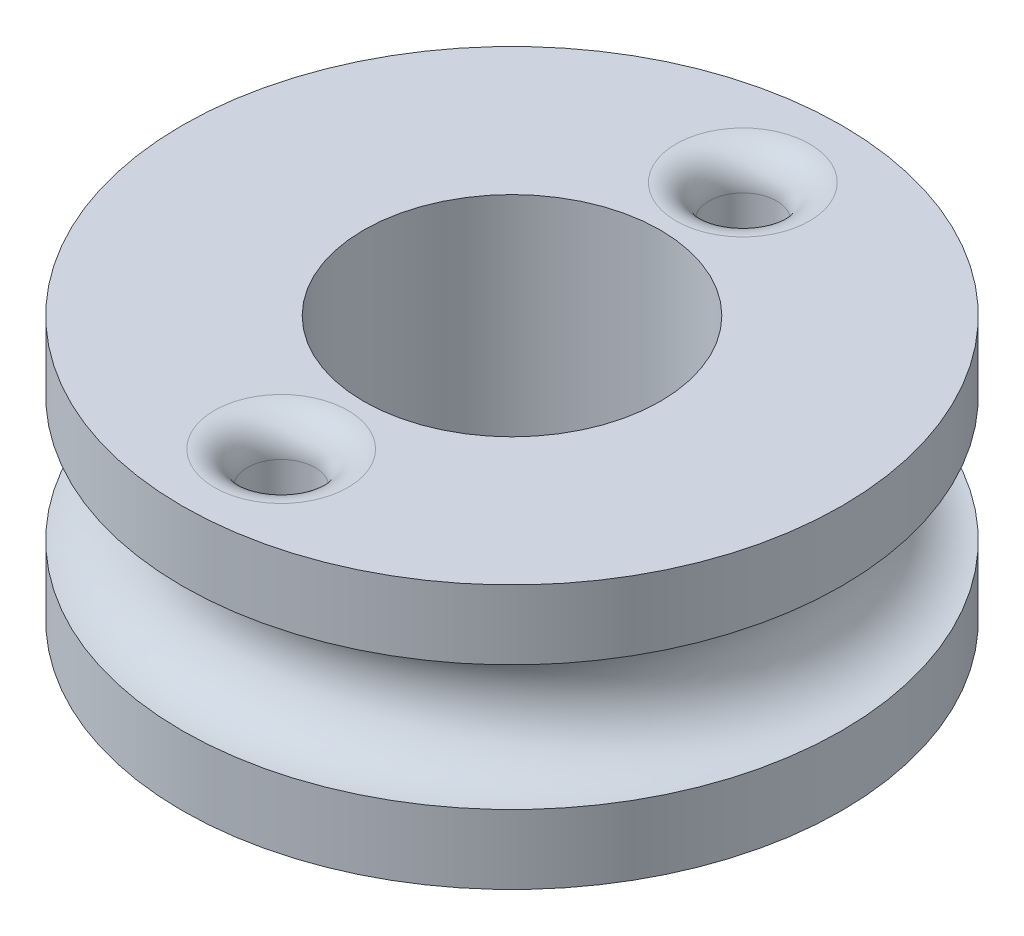
from build123d import *

# Parameters (mm, degrees)
SKETCH1_R           = 10
SKETCH1_R_2         = 4.5
BOSS_EXTRUDE1_DEPTH = 8
SKETCH3_R           = 1.9
SKETCH4_R           = 1.025
CUT_EXTRUDE1_DEPTH  = 8
FILLET3_R           = 1


with BuildPart() as part:
    # Sketch1 → Boss-Extrude1 (new body)
    with BuildSketch(Plane(origin=(0, 0, 0), x_dir=(1, 0, 0), z_dir=(0, 1, 0))):
        Circle(SKETCH1_R)
        Circle(SKETCH1_R_2, mode=Mode.SUBTRACT)
    extrude(amount=BOSS_EXTRUDE1_DEPTH)

    # Sketch3 → Cut-Revolve1 (revolve, cut)
    with BuildSketch(Plane.XY):
        with Locations((-10, 4)):
            Circle(SKETCH3_R)
    revolve(axis=Axis((0, -0.951898381, 0), (0, 1, 0)), mode=Mode.SUBTRACT)

    # Sketch4 → Cut-Extrude1 (cut)
    with BuildSketch(Plane(origin=(0, 0, 0), x_dir=(1, 0, 0), z_dir=(0, 1, 0))):
        with Locations((0, 7)):
            Circle(SKETCH4_R)
        with Locations((0, -7)):
            Circle(SKETCH4_R)
    extrude(amount=CUT_EXTRUDE1_DEPTH, mode=Mode.SUBTRACT)

    # Fillet3
    fillet3_edges = [part.edges().sort_by_distance(p)[0] for p in [
        (-1.025, 8, -7),
        (-1.025, 8, 7),
    ]]
    fillet(fillet3_edges, radius=FILLET3_R)


solid = part.part
